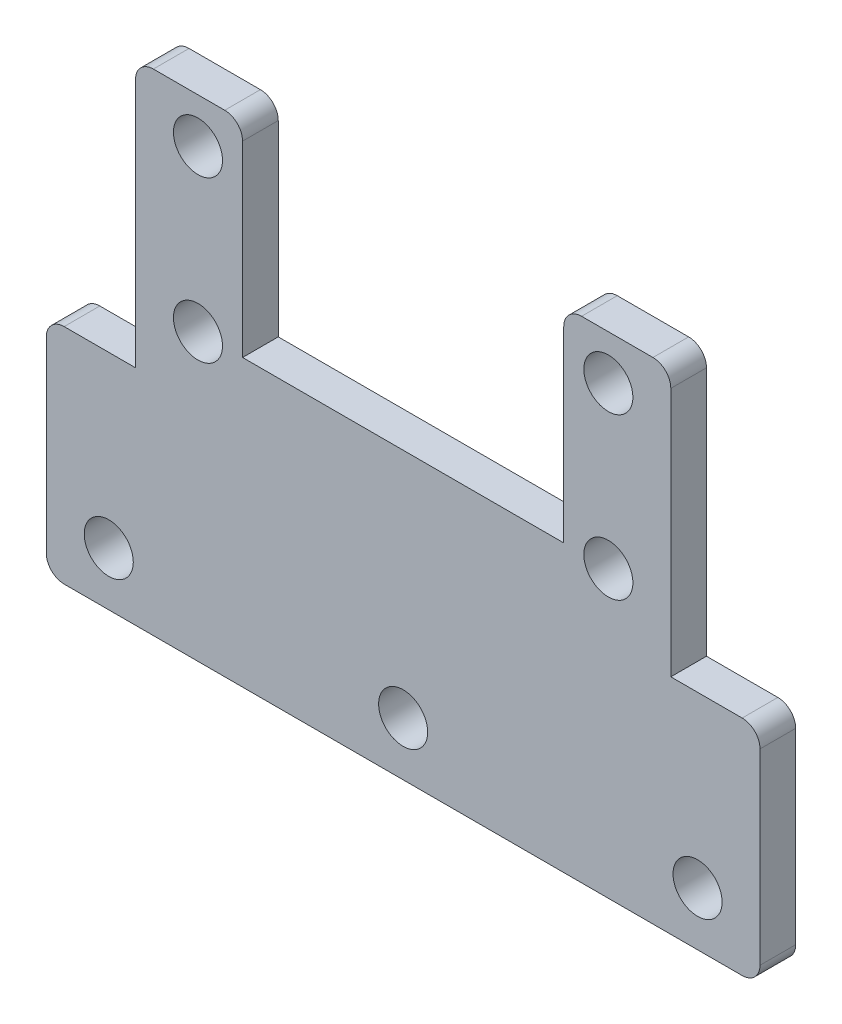
from build123d import *

# Parameters (mm, degrees)
SKETCH_1_R      = 2.75
EXTRUDE_1_DEPTH = 4
FILLET_1_R      = 2


with BuildPart() as part:
    # Эскиз1 → Бобышка-Вытянуть1 (new body)
    with BuildSketch(Plane.XY):
        Polygon((18, 0), (-18, 0), (-18, 23), (-30, 23), (-30, -7), (-40, -7), (-40, -32), (40, -32), (40, -7), (30, -7), (30, 23), (18, 23), align=None)
        with Locations((-23, 18)):
            Circle(SKETCH_1_R, mode=Mode.SUBTRACT)
        with Locations((-23, 0)):
            Circle(SKETCH_1_R, mode=Mode.SUBTRACT)
        with Locations((-33, -26)):
            Circle(SKETCH_1_R, mode=Mode.SUBTRACT)
        with Locations((0, -26)):
            Circle(SKETCH_1_R, mode=Mode.SUBTRACT)
        with Locations((33, -26)):
            Circle(SKETCH_1_R, mode=Mode.SUBTRACT)
        with Locations((23, 18)):
            Circle(SKETCH_1_R, mode=Mode.SUBTRACT)
        with Locations((23, 0)):
            Circle(SKETCH_1_R, mode=Mode.SUBTRACT)
    extrude(amount=EXTRUDE_1_DEPTH)

    # Скругление1
    fillet_1_edges = [part.edges().sort_by_distance(p)[0] for p in [
        (-18, 23, 2),
        (18, 23, 2),
        (30, 23, 2),
        (40, -7, 2),
        (40, -32, 2),
        (-40, -32, 2),
        (-40, -7, 2),
        (-30, 23, 2),
    ]]
    fillet(fillet_1_edges, radius=FILLET_1_R)


solid = part.part
